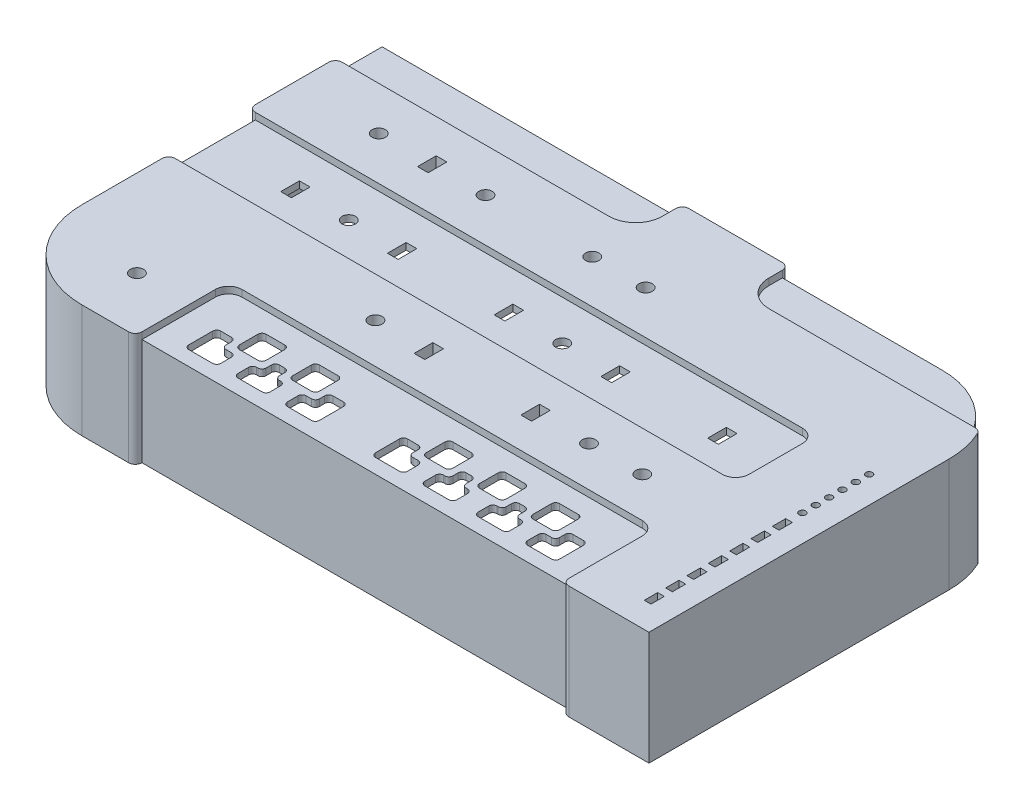
from build123d import *

# Parameters (mm, degrees)
SKETCH1_W           = 240
SKETCH1_H           = 140
BOSS_EXTRUDE1_DEPTH = 40
FILLET1_R           = 30
BOSS_EXTRUDE2_DEPTH = 42.5
CUT_EXTRUDE1_DEPTH  = 37.5
FILLET2_R           = 10
FILLET3_R           = 10
FILLET4_R           = 5
FILLET5_R           = 5
FILLET6_R           = 2.5
SKETCH4_R           = 2.5
SKETCH4_W           = 4
SKETCH4_H           = 7
CUT_EXTRUDE2_DEPTH  = 285.462211902
SKETCH5_W           = 10
SKETCH5_H           = 10
CUT_EXTRUDE3_DEPTH  = 285.099454417
CUT_EXTRUDE4_DEPTH  = 285.099454417
FILLET8_R           = 1.5
FILLET9_R           = 1.5
FILLET10_R          = 1.5
FILLET11_R          = 1.5
FILLET12_R          = 1.5
FILLET13_R          = 1.5
FILLET14_R          = 1.5
SKETCH7_R           = 1.25
SKETCH7_W           = 2.5
SKETCH7_H           = 5
CUT_EXTRUDE5_DEPTH  = 10


with BuildPart() as part:
    # Sketch1 → Boss-Extrude1 (new body)
    with BuildSketch(Plane(origin=(0, 0, 0), x_dir=(1, 0, 0), z_dir=(0, 1, 0))):
        with Locations((120, 70)):
            Rectangle(SKETCH1_W, SKETCH1_H)
    extrude(amount=BOSS_EXTRUDE1_DEPTH)

    # Fillet1
    fillet1_edges = [part.edges().sort_by_distance(p)[0] for p in [
        (240, 20, -140),
        (0, 20, 0),
    ]]
    fillet(fillet1_edges, radius=FILLET1_R)

    # Sketch2 → Boss-Extrude2 (add)
    with BuildSketch(Plane.XZ):
        with BuildLine():
            Line((110, -142.5), (110, -125))
            Line((110, -125), (-2.5, -125))
            Line((-2.5, -125), (-2.5, -92.5))
            Line((-2.5, -92.5), (210, -92.5))
            Line((210, -92.5), (210, -62.5))
            Line((210, -62.5), (-2.5, -62.5))
            Line((-2.5, -62.5), (-2.5, -30))
            ThreePointArc((-2.5, -30), (7.019029611, -7.019029611), (30, 2.5))
            Line((30, 2.5), (50, 2.5))
            Line((50, 2.5), (50, -32.5))
            Line((50, -32.5), (210, -32.5))
            Line((210, -32.5), (210, 2.5))
            Line((210, 2.5), (242.5, 2.5))
            Line((242.5, 2.5), (242.5, -110))
            ThreePointArc((242.5, -110), (241.569532075, -117.721052039), (238.831406487, -125))
            Line((238.831406487, -125), (150, -125))
            Line((150, -125), (150, -142.5))
            Line((150, -142.5), (110, -142.5))
        make_face()
    extrude(amount=-BOSS_EXTRUDE2_DEPTH)

    # Sketch3 → Cut-Extrude1 (cut)
    with BuildSketch(Plane.XZ):
        with BuildLine():
            Line((2.5, -57.5), (5, -57.5))
            Line((5, -57.5), (5, -97.5))
            Line((5, -97.5), (2.5, -97.5))
            Line((2.5, -97.5), (2.5, -120))
            Line((2.5, -120), (5, -120))
            Line((5, -120), (5, -135))
            Line((5, -135), (115, -135))
            Line((115, -135), (115, -137.5))
            Line((115, -137.5), (145, -137.5))
            Line((145, -137.5), (145, -135))
            Line((145, -135), (210, -135))
            ThreePointArc((210, -135), (223.693063938, -130.916500663), (232.912878475, -120))
            Line((232.912878475, -120), (235.617376915, -120))
            ThreePointArc((235.617376915, -120), (237.025246208, -115.087835239), (237.5, -110))
            Line((237.5, -110), (237.5, -2.5))
            Line((237.5, -2.5), (215, -2.5))
            Line((215, -2.5), (215, -5))
            Line((215, -5), (45, -5))
            Line((45, -5), (45, -2.5))
            Line((45, -2.5), (30, -2.5))
            ThreePointArc((30, -2.5), (10.554563517, -10.554563517), (2.5, -30))
            Line((2.5, -30), (2.5, -57.5))
        make_face()
    extrude(amount=-CUT_EXTRUDE1_DEPTH, mode=Mode.SUBTRACT)

    # Fillet2
    fillet2_edges = [part.edges().sort_by_distance(p)[0] for p in [
        (110, 41.25, -125),
    ]]
    fillet(fillet2_edges, radius=FILLET2_R)

    # Fillet3
    fillet3_edges = [part.edges().sort_by_distance(p)[0] for p in [
        (150, 41.25, -125),
    ]]
    fillet(fillet3_edges, radius=FILLET3_R)

    # Fillet4
    fillet4_edges = [part.edges().sort_by_distance(p)[0] for p in [
        (210, 41.25, -92.5),
        (210, 41.25, -62.5),
    ]]
    fillet(fillet4_edges, radius=FILLET4_R)

    # Fillet5
    fillet5_edges = [part.edges().sort_by_distance(p)[0] for p in [
        (50, 41.25, -32.5),
        (210, 41.25, -32.5),
    ]]
    fillet(fillet5_edges, radius=FILLET5_R)

    # Fillet6
    fillet6_edges = [part.edges().sort_by_distance(p)[0] for p in [
        (-2.5, 21.25, -125),
        (-2.5, 21.25, -92.5),
        (-2.5, 21.25, -62.5),
        (50, 21.25, 2.5),
        (210, 21.25, 2.5),
        (238.831406487, 21.25, -125),
        (150, 21.25, -142.5),
        (110, 21.25, -142.5),
    ]]
    fillet(fillet6_edges, radius=FILLET6_R - 0.0001)  # a hair under: the kernel refuses the full size

    # Sketch4 → Cut-Extrude2 (cut, through all)
    with BuildSketch(Plane(origin=(0, 42.5, 0), x_dir=(1, 0, 0), z_dir=(0, 1, 0))):
        with Locations(Location((30, 108.75, 0), (0, 0, 270))):
            Circle(SKETCH4_R)
        with Locations(Location((70, 108.75, 0), (0, 0, 270))):
            Circle(SKETCH4_R)
        with Locations(Location((110, 108.75, 0), (0, 0, 270))):
            Circle(SKETCH4_R)
        with Locations(Location((130, 108.75, 0), (0, 0, 270))):
            Circle(SKETCH4_R)
        with Locations(Location((130, 77.5, 0), (0, 0, 90))):
            Circle(SKETCH4_R)
        with Locations(Location((190, 47.5, 0), (0, 0, 270))):
            Circle(SKETCH4_R)
        with Locations(Location((170, 47.5, 0), (0, 0, 270))):
            Circle(SKETCH4_R)
        with Locations(Location((90, 47.5, 0), (0, 0, 270))):
            Circle(SKETCH4_R)
        with Locations(Location((30, 18.1, 0), (0, 0, 270))):
            Circle(SKETCH4_R)
        with Locations(Location((50, 77.5, 0), (0, 0, 90))):
            Circle(SKETCH4_R)
        with Locations((50, 108.75)):
            Rectangle(SKETCH4_W, SKETCH4_H)
        with Locations((30, 77.5)):
            Rectangle(SKETCH4_W, SKETCH4_H)
        with Locations((70, 77.5)):
            Rectangle(SKETCH4_W, SKETCH4_H)
        with Locations((110, 77.5)):
            Rectangle(SKETCH4_W, SKETCH4_H)
        with Locations((150, 77.5)):
            Rectangle(SKETCH4_W, SKETCH4_H)
        with Locations((190, 77.5)):
            Rectangle(SKETCH4_W, SKETCH4_H)
        with Locations((110, 47.5)):
            Rectangle(SKETCH4_W, SKETCH4_H)
        with Locations((150, 47.5)):
            Rectangle(SKETCH4_W, SKETCH4_H)
    extrude(amount=-CUT_EXTRUDE2_DEPTH, mode=Mode.SUBTRACT)

    # Sketch5 → Cut-Extrude3 (cut, through all)
    with BuildSketch(Plane(origin=(0, 40, 0), x_dir=(1, 0, 0), z_dir=(0, 1, 0))):
        with Locations((75, 20)):
            Rectangle(SKETCH5_W, SKETCH5_H)
        with Locations((95, 20)):
            Rectangle(SKETCH5_W, SKETCH5_H)
        with Locations((145, 20)):
            Rectangle(SKETCH5_W, SKETCH5_H)
        with Locations((165, 20)):
            Rectangle(SKETCH5_W, SKETCH5_H)
        with Locations((185, 20)):
            Rectangle(SKETCH5_W, SKETCH5_H)
    extrude(amount=-CUT_EXTRUDE3_DEPTH, mode=Mode.SUBTRACT)

    # Sketch6 → Cut-Extrude4 (cut, through all)
    with BuildSketch(Plane(origin=(0, 40, 0), x_dir=(1, 0, 0), z_dir=(0, 1, 0))):
        Polygon((60.5, 17.5), (67.5, 17.5), (67.5, 12.5), (72.5, 12.5), (72.5, 5.5), (60.5, 5.5), align=None)
        Polygon((82.5, 17.5), (82.5, 12.5), (79, 12.5), (79, 5.5), (91, 5.5), (91, 12.5), (87.5, 12.5), (87.5, 17.5), align=None)
        Polygon((97.5, 12.5), (102.5, 12.5), (102.5, 17.5), (109.5, 17.5), (109.5, 5.5), (97.5, 5.5), align=None)
        Polygon((137.5, 17.5), (137.5, 12.5), (142.5, 12.5), (142.5, 5.5), (130.5, 5.5), (130.5, 17.5), align=None)
        Polygon((152.5, 17.5), (152.5, 12.5), (149, 12.5), (149, 5.5), (161, 5.5), (161, 12.5), (157.5, 12.5), (157.5, 17.5), align=None)
        Polygon((172.5, 17.5), (172.5, 12.5), (169, 12.5), (169, 5.5), (181, 5.5), (181, 12.5), (177.5, 12.5), (177.5, 17.5), align=None)
        Polygon((187.5, 12.5), (192.5, 12.5), (192.5, 17.5), (199.5, 17.5), (199.5, 5.5), (187.5, 5.5), align=None)
    extrude(amount=-CUT_EXTRUDE4_DEPTH, mode=Mode.SUBTRACT)

    # Fillet8
    fillet8_edges = [part.edges().sort_by_distance(p)[0] for p in [
        (70, 38.75, -25),
        (90, 38.75, -25),
        (60.5, 38.75, -17.5),
        (82.5, 38.75, -17.5),
        (79, 38.75, -12.5),
        (82.5, 38.75, -12.5),
        (102.5, 38.75, -12.5),
        (102.5, 38.75, -17.5),
    ]]
    fillet(fillet8_edges, radius=FILLET8_R)

    # Fillet9
    fillet9_edges = [part.edges().sort_by_distance(p)[0] for p in [
        (80, 38.75, -25),
        (100, 38.75, -25),
        (67.5, 38.75, -17.5),
        (67.5, 38.75, -12.5),
        (72.5, 38.75, -12.5),
        (87.5, 38.75, -17.5),
        (87.5, 38.75, -12.5),
        (91, 38.75, -12.5),
        (109.5, 38.75, -17.5),
    ]]
    fillet(fillet9_edges, radius=FILLET9_R)

    # Fillet10
    fillet10_edges = [part.edges().sort_by_distance(p)[0] for p in [
        (97.5, 38.75, -12.5),
    ]]
    fillet(fillet10_edges, radius=FILLET10_R)

    # Fillet11
    fillet11_edges = [part.edges().sort_by_distance(p)[0] for p in [
        (140, 38.75, -25),
        (160, 38.75, -25),
        (180, 38.75, -25),
        (130.5, 38.75, -17.5),
        (152.5, 38.75, -17.5),
        (149, 38.75, -12.5),
        (152.5, 38.75, -12.5),
        (172.5, 38.75, -17.5),
        (169, 38.75, -12.5),
        (172.5, 38.75, -12.5),
        (187.5, 38.75, -12.5),
        (192.5, 38.75, -12.5),
        (192.5, 38.75, -17.5),
    ]]
    fillet(fillet11_edges, radius=FILLET11_R)

    # Fillet12
    fillet12_edges = [part.edges().sort_by_distance(p)[0] for p in [
        (150, 38.75, -25),
        (170, 38.75, -25),
        (190, 38.75, -25),
        (137.5, 38.75, -17.5),
        (137.5, 38.75, -12.5),
        (142.5, 38.75, -12.5),
        (157.5, 38.75, -17.5),
        (157.5, 38.75, -12.5),
        (161, 38.75, -12.5),
        (177.5, 38.75, -17.5),
        (177.5, 38.75, -12.5),
        (181, 38.75, -12.5),
        (199.5, 38.75, -17.5),
    ]]
    fillet(fillet12_edges, radius=FILLET12_R)

    # Fillet13
    fillet13_edges = [part.edges().sort_by_distance(p)[0] for p in [
        (80, 38.75, -15),
        (100, 38.75, -15),
        (150, 38.75, -15),
        (170, 38.75, -15),
        (190, 38.75, -15),
        (72.5, 38.75, -5.5),
        (91, 38.75, -5.5),
        (109.5, 38.75, -5.5),
        (142.5, 38.75, -5.5),
        (161, 38.75, -5.5),
        (181, 38.75, -5.5),
        (199.5, 38.75, -5.5),
    ]]
    fillet(fillet13_edges, radius=FILLET13_R)

    # Fillet14
    fillet14_edges = [part.edges().sort_by_distance(p)[0] for p in [
        (70, 38.75, -15),
        (90, 38.75, -15),
        (140, 38.75, -15),
        (160, 38.75, -15),
        (180, 38.75, -15),
        (60.5, 38.75, -5.5),
        (79, 38.75, -5.5),
        (97.5, 38.75, -5.5),
        (130.5, 38.75, -5.5),
        (149, 38.75, -5.5),
        (169, 38.75, -5.5),
        (187.5, 38.75, -5.5),
    ]]
    fillet(fillet14_edges, radius=FILLET14_R)

    # Sketch7 → Cut-Extrude5 (cut)
    with BuildSketch(Plane(origin=(0, 42.5, 0), x_dir=(1, 0, 0), z_dir=(0, 1, 0))):
        with Locations(Location((232.5, 90, 0), (0, 0, 270))):
            Circle(SKETCH7_R)
        with Locations(Location((232.5, 85, 0), (0, 0, 270))):
            Circle(SKETCH7_R)
        with Locations(Location((232.5, 80, 0), (0, 0, 270))):
            Circle(SKETCH7_R)
        with Locations(Location((232.5, 75, 0), (0, 0, 90))):
            Circle(SKETCH7_R)
        with Locations(Location((232.5, 70, 0), (0, 0, 90))):
            Circle(SKETCH7_R)
        with Locations(Location((232.5, 65, 0), (0, 0, 90))):
            Circle(SKETCH7_R)
        with Locations((232.5, 57.5)):
            Rectangle(SKETCH7_W, SKETCH7_H)
        with Locations((232.5, 49.5)):
            Rectangle(SKETCH7_W, SKETCH7_H)
        with Locations((232.5, 41.5)):
            Rectangle(SKETCH7_W, SKETCH7_H)
        with Locations((232.5, 33.5)):
            Rectangle(SKETCH7_W, SKETCH7_H)
        with Locations((232.5, 25.5)):
            Rectangle(SKETCH7_W, SKETCH7_H)
        with Locations((232.5, 17.5)):
            Rectangle(SKETCH7_W, SKETCH7_H)
        with Locations((232.5, 9.5)):
            Rectangle(SKETCH7_W, SKETCH7_H)
    extrude(amount=-CUT_EXTRUDE5_DEPTH, mode=Mode.SUBTRACT)


solid = part.part
